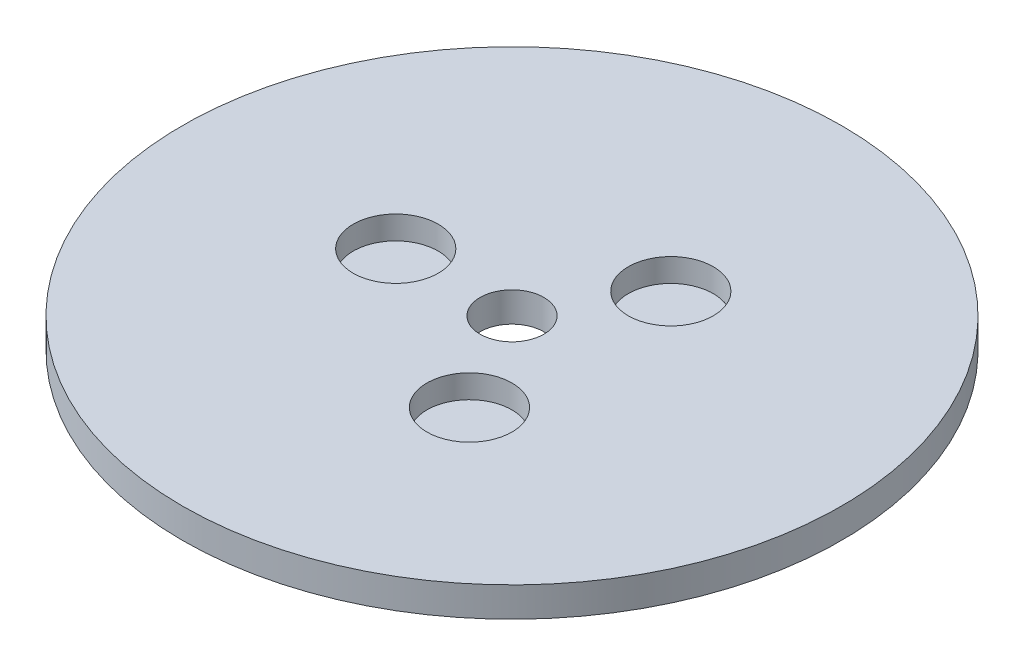
from build123d import *

# Parameters (mm, degrees)
SKETCH1_R           = 77.5
BOSS_EXTRUDE1_DEPTH = 7
SKETCH2_R           = 7.5
CUT_EXTRUDE1_DEPTH  = 110.824860574
SKETCH3_R           = 10
CUT_EXTRUDE2_DEPTH  = 5.482593841
CIRPATTERN1_COUNT   = 3


with BuildPart() as part:
    # Sketch1 → Boss-Extrude1 (new body)
    with BuildSketch(Plane(origin=(0, 0, 0), x_dir=(1, 0, 0), z_dir=(0, 1, 0))):
        Circle(SKETCH1_R)
    extrude(amount=BOSS_EXTRUDE1_DEPTH)

    # Sketch2 → Cut-Extrude1 (cut, through all)
    with BuildSketch(Plane(origin=(0, 0, 0), x_dir=(1, 0, 0), z_dir=(0, 1, 0))):
        Circle(SKETCH2_R)
    extrude(amount=CUT_EXTRUDE1_DEPTH, mode=Mode.SUBTRACT)

    # Sketch3 → Cut-Extrude2 (cut)
    with BuildSketch(Plane(origin=(0, 7, 0), x_dir=(1, 0, 0), z_dir=(0, 1, 0))):
        with Locations((-27.339791906, 0)):
            Circle(SKETCH3_R)
    cut_extrude2 = extrude(amount=-CUT_EXTRUDE2_DEPTH, mode=Mode.SUBTRACT)

    # CirPattern1: Cut-Extrude2 ×3 about axis
    cirpattern1_axis = Axis((0, 0, 0), (0, 1, 0))
    for i in range(1, CIRPATTERN1_COUNT):
        add(cut_extrude2.rotate(cirpattern1_axis, i * 360 / CIRPATTERN1_COUNT), mode=Mode.SUBTRACT)


solid = part.part
